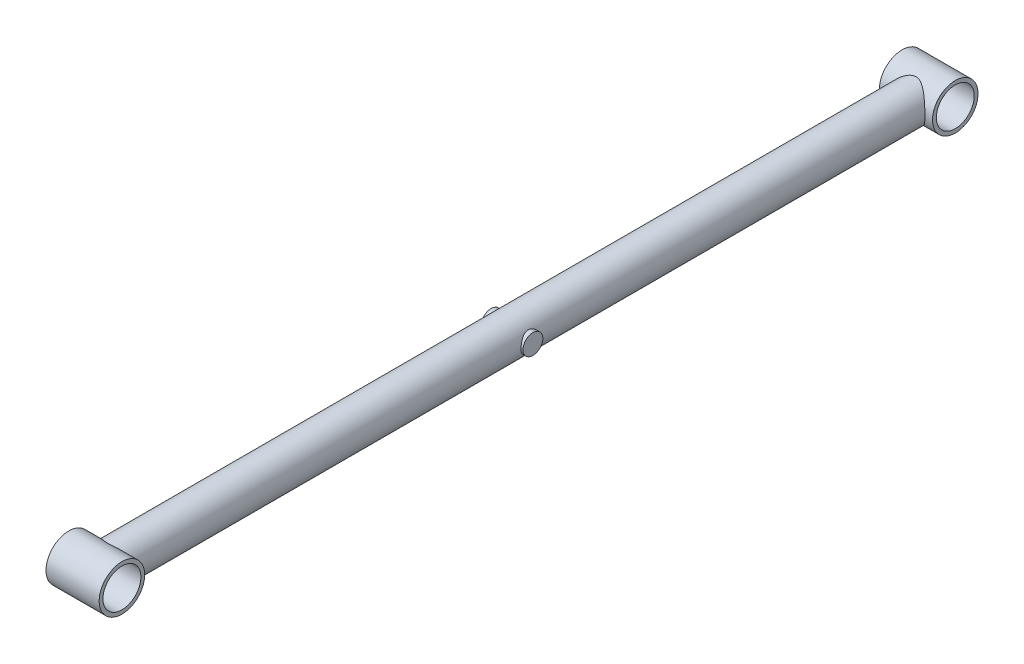
from build123d import *
from build123d.topology import SkipClean

# Parameters (mm, degrees)
SKETCH2_R                = 12.7
SKETCH4_R                = 15.24
SKETCH5_R                = 15.24
BOSS_EXTRUDE1_DEPTH      = 17.78
SKETCH7_R                = 12.7
CUT_EXTRUDE1_DEPTH       = 575.189120366
BOSS_EXTRUDE2_DEPTH      = 13.97
BOSS_EXTRUDE2_DEPTH_BACK = 13.97
SKETCH8_R                = 6.649982279


with BuildPart() as part:
    # Sweep1: sweep along a path in Sketch1
    with BuildLine(Plane(origin=(0, 0, 0), x_dir=(0, 0, -1), z_dir=(1, 0, 0))) as sweep1_path:
        Line((0, 0), (-557.64425936, 0))
    # Sketch2 → Sweep1 (sweep)
    with BuildSketch(Plane.XY):
        Circle(SKETCH2_R)
    sweep(path=sweep1_path.line)

    # Sweep2: sweep along a path in Sketch3
    with BuildLine(Plane(origin=(0, 0, 0), x_dir=(1, 0, 0), z_dir=(0, 1, 0))) as sweep2_path:
        Line((0, -557.64425936), (17.78, -557.64425936))
    # Sketch4 → Sweep2 (sweep)
    with BuildSketch(Plane(origin=(0, 0, 0), x_dir=(0, 0, -1), z_dir=(1, 0, 0))):
        with Locations((-557.64425936, 0)):
            Circle(SKETCH4_R)
    sweep2 = sweep(path=sweep2_path.line)

    # Sketch5 → Boss-Extrude1 (add)
    with SkipClean():  # the faces are left unmerged after this step: merging them gives an invalid solid
        with BuildSketch(Plane.ZY):
            with Locations((557.64425936, 0)):
                Circle(SKETCH5_R)
        boss_extrude1 = extrude(amount=BOSS_EXTRUDE1_DEPTH)
    add(part.part.scale(1), mode=Mode.REPLACE)  # the faces are merged on a copy

    # Sketch7 → Cut-Extrude1 (cut, through all)
    with BuildSketch(Plane.ZY.offset(17.78)):
        with Locations((557.64425936, 0)):
            Circle(SKETCH7_R)
    cut_extrude1 = extrude(amount=-CUT_EXTRUDE1_DEPTH, mode=Mode.SUBTRACT)

    # Mirror1: Sweep2, Boss-Extrude1, Cut-Extrude1 across plane
    add(sweep2.mirror(Plane.XY.offset(278.82212968)))
    add(boss_extrude1.mirror(Plane.XY.offset(278.82212968)))
    add(cut_extrude1.mirror(Plane.XY.offset(278.82212968)), mode=Mode.SUBTRACT)

    # Sketch8 → Boss-Extrude2 (add, two sides: drawn at the far end of the back side and taken through both)
    with BuildSketch(Plane(origin=(0, 0, 0), x_dir=(0, 0, -1), z_dir=(1, 0, 0)).offset(-BOSS_EXTRUDE2_DEPTH_BACK)):
        with Locations((-278.82212968, 0)):
            Circle(SKETCH8_R)
    extrude(amount=BOSS_EXTRUDE2_DEPTH + BOSS_EXTRUDE2_DEPTH_BACK)


solid = part.part
